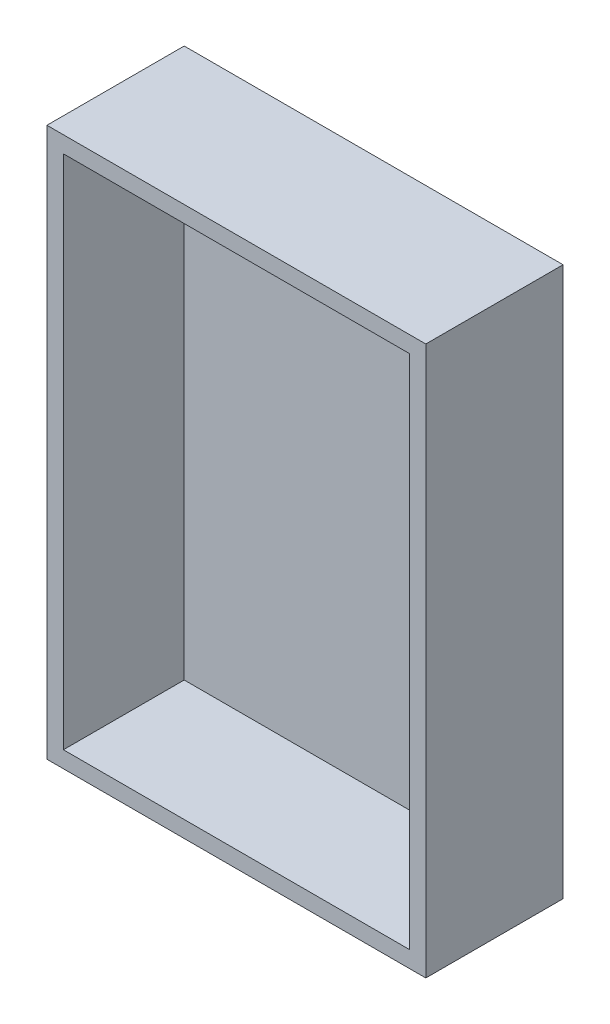
from build123d import *

# Parameters (mm, degrees)
IZIM1_W                     = 69
IZIM1_H                     = 100
Y_KSEKLIK_EKSTR_ZYON1_DEPTH = 3
IZIM2_W                     = 69
IZIM2_H                     = 100
IZIM2_W_2                   = 63
IZIM2_H_2                   = 94
Y_KSEKLIK_EKSTR_ZYON2_DEPTH = 22


with BuildPart() as part:
    # Çizim1 → Yükseklik-Ekstrüzyon1 (new body)
    with BuildSketch(Plane.XY):
        Rectangle(IZIM1_W, IZIM1_H)
    extrude(amount=Y_KSEKLIK_EKSTR_ZYON1_DEPTH)

    # Çizim2 → Yükseklik-Ekstrüzyon2 (add)
    with BuildSketch(Plane.XY.offset(3)):
        Rectangle(IZIM2_W, IZIM2_H)
        Rectangle(IZIM2_W_2, IZIM2_H_2, mode=Mode.SUBTRACT)
    extrude(amount=Y_KSEKLIK_EKSTR_ZYON2_DEPTH)


solid = part.part
